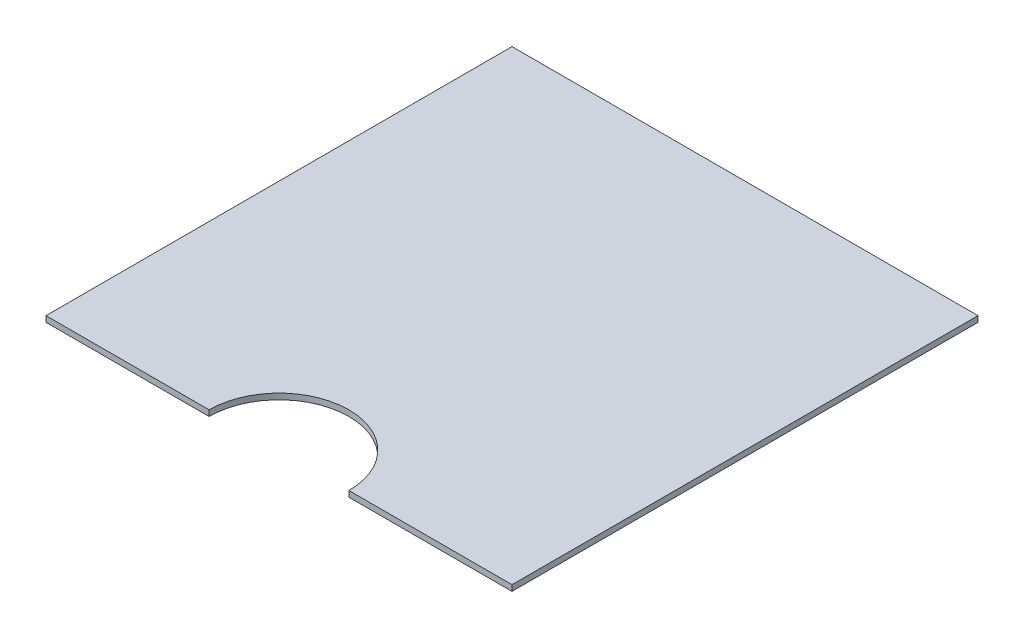
from build123d import *

# Parameters (mm, degrees)
SKETCH1_W           = 400
SKETCH1_H           = 400
BOSS_EXTRUDE1_DEPTH = 5
CUT_EXTRUDE1_DEPTH  = 10


with BuildPart() as part:
    # Sketch1 → Boss-Extrude1 (new body)
    with BuildSketch(Plane(origin=(0, 0, 0), x_dir=(1, 0, 0), z_dir=(0, 1, 0))):
        Rectangle(SKETCH1_W, SKETCH1_H)
    extrude(amount=BOSS_EXTRUDE1_DEPTH)

    # Sketch2 → Cut-Extrude1 (cut)
    with BuildSketch(Plane(origin=(0, 5, 0), x_dir=(1, 0, 0), z_dir=(0, 1, 0))):
        with BuildLine():
            Line((-60, -200), (60, -200))
            ThreePointArc((60, -200), (0, -140), (-60, -200))
        make_face()
    extrude(amount=-CUT_EXTRUDE1_DEPTH, mode=Mode.SUBTRACT)


solid = part.part
